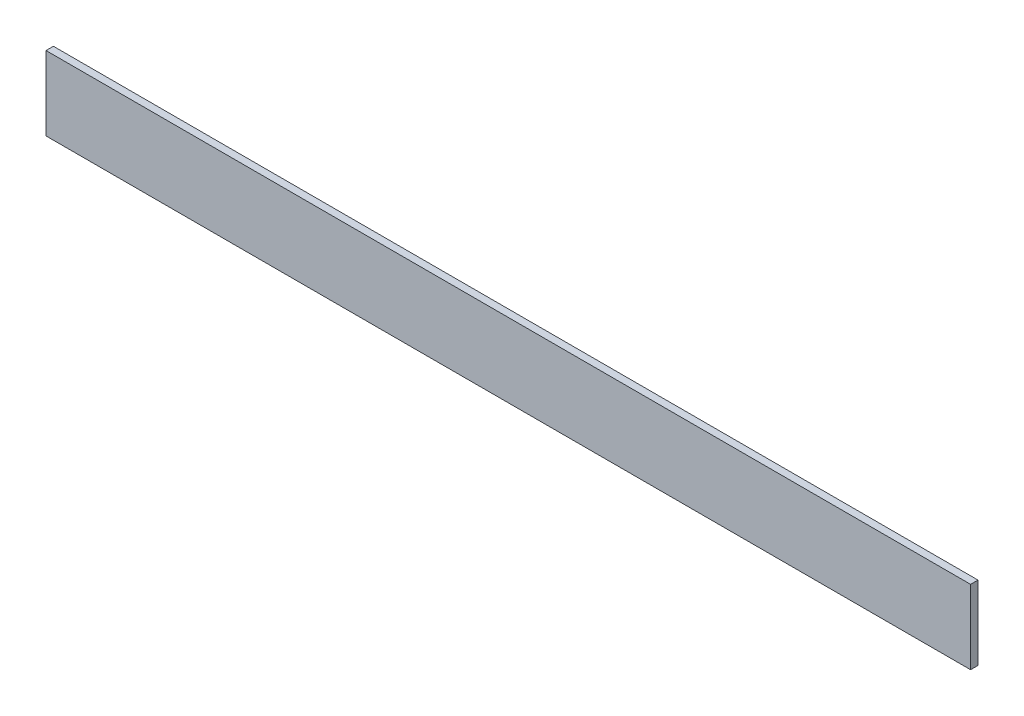
from build123d import *

# Parameters (mm, degrees)
IZIM1_W            = 1000
IZIM1_H            = 80
TABAN_FLAN_1_DEPTH = 8


# Sheet-metal steps are written as plain solids
with BuildPart() as part:
    # Çizim1 → Taban-Flanş1 (new body)
    with BuildSketch(Plane.XY):
        with Locations((500, -40)):
            Rectangle(IZIM1_W, IZIM1_H)
    extrude(amount=-TABAN_FLAN_1_DEPTH)


solid = part.part
